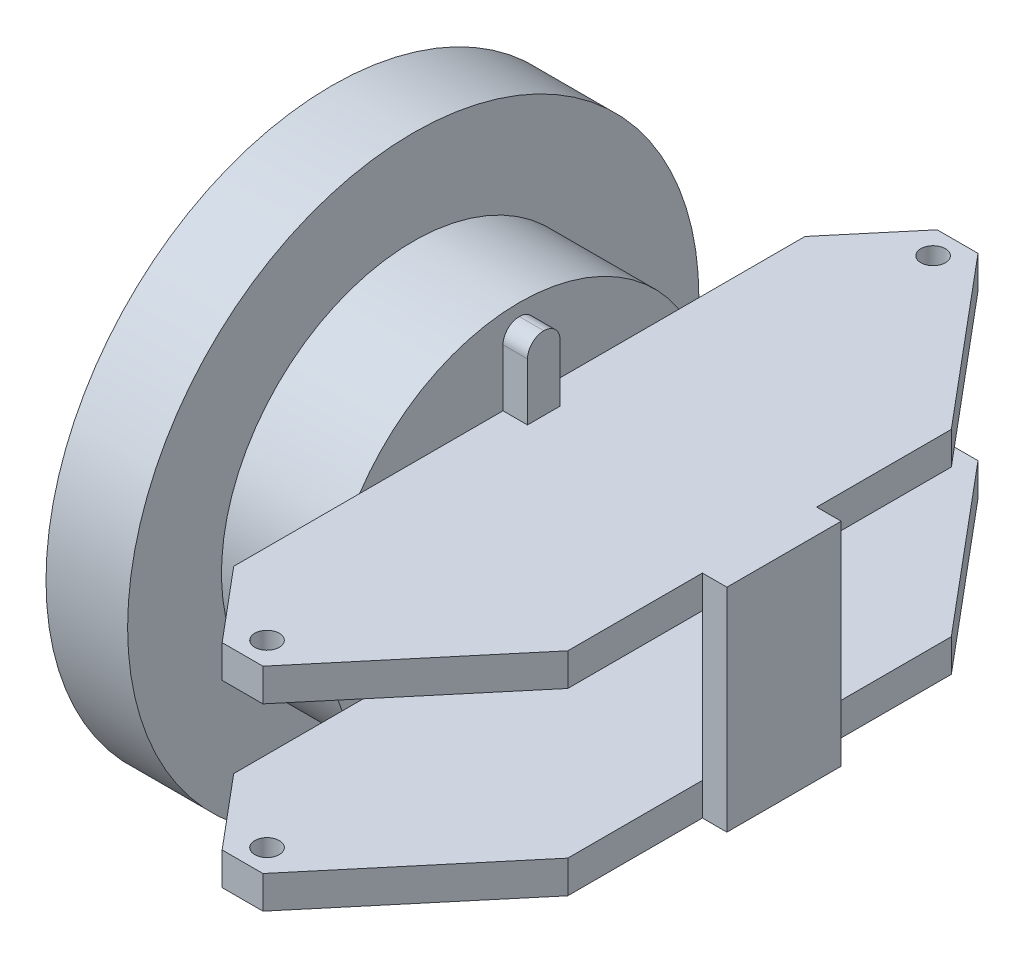
from build123d import *

# Parameters (mm, degrees)
SKETCH1_R               = 35
BOSS_EXTRUDE1_DEPTH     = 10
SKETCH2_R               = 23.5
BOSS_EXTRUDE2_DEPTH     = 13
BOSS_EXTRUDE3_DEPTH     = 4
SKETCH4_R               = 1.5
CUT_EXTRUDE1_DEPTH      = 4
MIRROR2_COPY_1_SKETCH_R = 1.5
MIRROR2_COPY_1_DEPTH    = 4
BOSS_EXTRUDE4_DEPTH     = 3
FILLET1_R               = 2
FILLET1_OF_MIRROR3_R    = 2
SKETCH6_W               = 14
SKETCH6_H               = 26
BOSS_EXTRUDE5_DEPTH     = 3
SKETCH7_R               = 10
CUT_EXTRUDE2_DEPTH      = 10


with BuildPart() as part:
    # Sketch1 → Boss-Extrude1 (new body)
    with BuildSketch(Plane(origin=(0, 0, 0), x_dir=(0, 0, -1), z_dir=(1, 0, 0))):
        Circle(SKETCH1_R)
    extrude(amount=BOSS_EXTRUDE1_DEPTH)

    # Sketch2 → Boss-Extrude2 (add)
    with BuildSketch(Plane(origin=(10, 0, 0), x_dir=(0, 0, -1), z_dir=(1, 0, 0))):
        with Locations(Location((0, 0, 0), (0, 0, 180))):
            Circle(SKETCH2_R)
    extrude(amount=BOSS_EXTRUDE2_DEPTH)

    # Sketch3 → Boss-Extrude3 (add)
    with BuildSketch(Plane(origin=(0, 13, 0), x_dir=(1, 0, 0), z_dir=(0, 1, 0))):
        Polygon((23, 35), (23, -35), (30.392057511, -43.809511096), (35.392057511, -43.809511096), (52.433760781, -23.5), (52.433760781, 23.5), (35.392057511, 43.809511096), (30.392057511, 43.809511096), align=None)
    boss_extrude3 = extrude(amount=-BOSS_EXTRUDE3_DEPTH)

    # Sketch4 → Cut-Extrude1 (cut)
    with BuildSketch(Plane(origin=(0, 13, 0), x_dir=(1, 0, 0), z_dir=(0, 1, 0))):
        with Locations(Location((32.892057511, -40.809511096, 0), (0, 0, 270))):
            Circle(SKETCH4_R)
    cut_extrude1 = extrude(amount=-CUT_EXTRUDE1_DEPTH, mode=Mode.SUBTRACT)

    # Mirror1: Cut-Extrude1 across plane
    add(cut_extrude1.mirror(Plane.XY), mode=Mode.SUBTRACT)

    # Mirror2: Boss-Extrude3, Cut-Extrude1 across plane
    add(boss_extrude3.mirror(Plane.ZX))
    add(cut_extrude1.mirror(Plane.ZX), mode=Mode.SUBTRACT)

    # Mirror2 copy 1 sketch → Mirror2 copy 1 (cut)
    with BuildSketch(Plane.XZ.offset(13)):
        with Locations(Location((32.892057511, -40.809511096, 0), (0, 0, 270))):
            Circle(MIRROR2_COPY_1_SKETCH_R)
    extrude(amount=-MIRROR2_COPY_1_DEPTH, mode=Mode.SUBTRACT)

    # Sketch5 → Boss-Extrude4 (add)
    with BuildSketch(Plane(origin=(23, 0, 0), x_dir=(0, 0, -1), z_dir=(1, 0, 0))):
        Polygon((0, 13), (-2, 13), (-2, 22), (2, 22), (2, 13), align=None)
    boss_extrude4 = extrude(amount=BOSS_EXTRUDE4_DEPTH)

    # Fillet1
    fillet1_edges = [part.edges().sort_by_distance(p)[0] for p in [
        (24.5, 22, 2),
        (24.5, 22, -2),
    ]]
    fillet(fillet1_edges, radius=FILLET1_R - 0.0001)  # a hair under: the kernel refuses the full size

    # Mirror3: Boss-Extrude4 across plane
    add(boss_extrude4.mirror(Plane.ZX))

    # Fillet1 of Mirror3
    fillet1_of_mirror3_edges = [part.edges().sort_by_distance(p)[0] for p in [
        (24.5, -22, 2),
        (24.5, -22, -2),
    ]]
    fillet(fillet1_of_mirror3_edges, radius=FILLET1_OF_MIRROR3_R - 0.0001)  # a hair under: the kernel refuses the full size

    # Sketch6 → Boss-Extrude5 (add)
    with BuildSketch(Plane(origin=(52.433760781, 0, 0), x_dir=(0, 0, -1), z_dir=(1, 0, 0))):
        Rectangle(SKETCH6_W, SKETCH6_H)
    extrude(amount=BOSS_EXTRUDE5_DEPTH)

    # Sketch7 → Cut-Extrude2 (cut)
    with BuildSketch(Plane.ZY):
        Circle(SKETCH7_R)
    extrude(amount=-CUT_EXTRUDE2_DEPTH, mode=Mode.SUBTRACT)


solid = part.part
